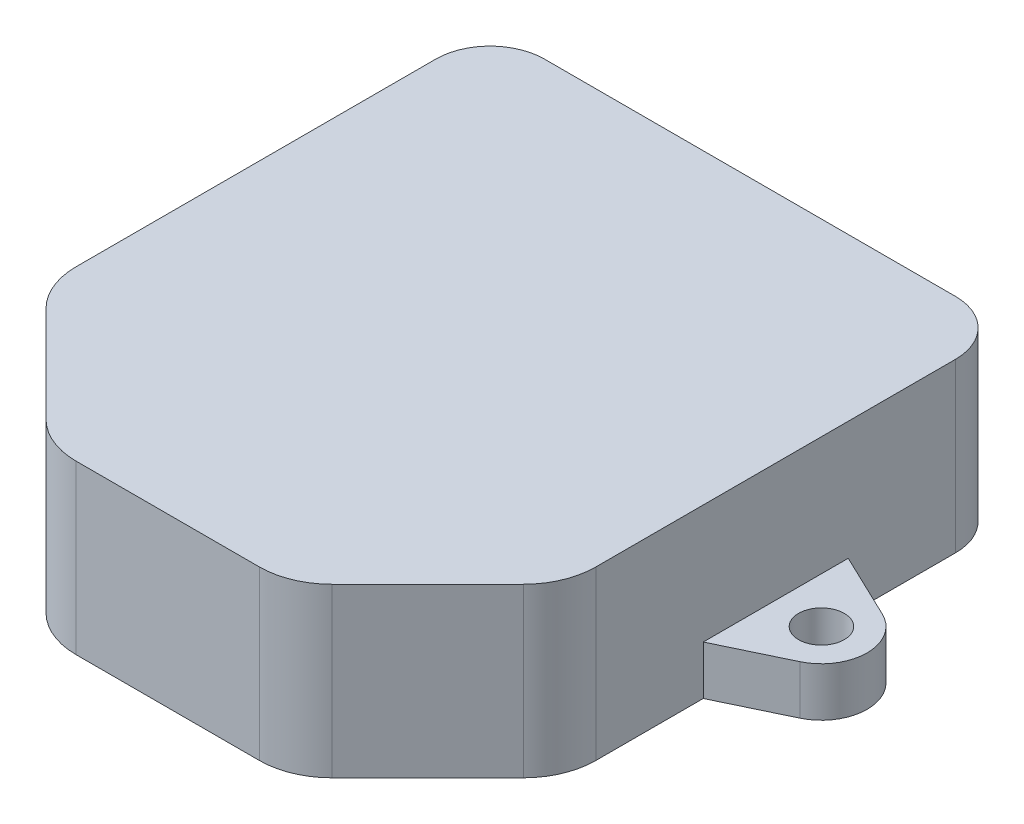
from build123d import *

# Parameters (mm, degrees)
BOSS_EXTRUDE1_DEPTH     = 2.54
BOSS_EXTRUDE2_START     = -23.495
BOSS_EXTRUDE2_DEPTH     = 23.495
CUT_EXTRUDE2_DEPTH      = 20.955
BOSS_EXTRUDE3_DEPTH     = 2.54
SKETCH11_R              = 1.27
BOSS_EXTRUDE4_DEPTH     = 2.54
CUT_EXTRUDE3_DEPTH      = 2.54
CUT_EXTRUDE4_DEPTH      = 2.54
CUT_EXTRUDE4_DEPTH_BACK = 2.54
SKETCH15_W              = 0.800537806
SKETCH15_H              = 10.431424645
SPLIT1_START            = -2.54
SPLIT1_DEPTH            = 11.7475
SKETCH16_R              = 3.2004
SKETCH16_R_2            = 1.6002
SKETCH16_R_3            = 1.27
BOSS_EXTRUDE5_DEPTH     = 3.429
SKETCH21_R              = 1.27
BOSS_EXTRUDE6_DEPTH     = 3.81


# Read off the part's stored shape, not the designer's step: Split1
with BuildPart() as part:
    # Sketch1 → Boss-Extrude1 (new body)
    # profile 1 of 2: a face of its own
    with BuildSketch(Plane(origin=(0, 0, 0), x_dir=(1, 0, 0), z_dir=(0, 1, 0))):
        with BuildLine():
            Line((-1.778, 0), (-1.778, -25.207897552))
            ThreePointArc((-1.778, -25.207897552), (-1.545984815, -26.374316653), (-0.885261469, -27.363159021))
            Line((-0.885261469, -27.363159021), (5.826840979, -34.075261469))
            ThreePointArc((5.826840979, -34.075261469), (6.815683347, -34.735984815), (7.982102448, -34.968))
            Line((7.982102448, -34.968), (20.827897552, -34.968))
            ThreePointArc((20.827897552, -34.968), (21.994316653, -34.735984815), (22.983159021, -34.075261469))
            Line((22.983159021, -34.075261469), (29.695261469, -27.363159021))
            ThreePointArc((29.695261469, -27.363159021), (30.355984815, -26.374316653), (30.588, -25.207897552))
            Line((30.588, -25.207897552), (30.588, 0))
            ThreePointArc((30.588, 0), (30.067235857, 1.257235857), (28.81, 1.778))
            Line((28.81, 1.778), (0, 1.778))
            ThreePointArc((0, 1.778), (-1.257235857, 1.257235857), (-1.778, 0))
        make_face()
        with BuildLine():
            ThreePointArc((0, 1.27), (-0.898025612, 0.898025612), (-1.27, 0))
            Line((-1.27, 0), (-1.27, -25.207897552))
            ThreePointArc((-1.27, -25.207897552), (-1.076654013, -26.17991347), (-0.526051224, -27.003948776))
            Line((-0.526051224, -27.003948776), (6.186051224, -33.716051224))
            ThreePointArc((6.186051224, -33.716051224), (7.01008653, -34.266654013), (7.982102448, -34.46))
            Line((7.982102448, -34.46), (20.827897552, -34.46))
            ThreePointArc((20.827897552, -34.46), (21.79991347, -34.266654013), (22.623948776, -33.716051224))
            Line((22.623948776, -33.716051224), (29.336051224, -27.003948776))
            ThreePointArc((29.336051224, -27.003948776), (29.886654013, -26.17991347), (30.08, -25.207897552))
            Line((30.08, -25.207897552), (30.08, 0))
            ThreePointArc((30.08, 0), (29.708025612, 0.898025612), (28.81, 1.27))
            Line((28.81, 1.27), (0, 1.27))
        make_face(mode=Mode.SUBTRACT)
    # profile 2 of 2: a face of its own
    with BuildSketch(Plane(origin=(0, 0, 0), x_dir=(1, 0, 0), z_dir=(0, 1, 0))):
        with BuildLine():
            Line((28.81, 1.27), (0, 1.27))
            ThreePointArc((0, 1.27), (-0.898025612, 0.898025612), (-1.27, 0))
            Line((-1.27, 0), (-1.27, -25.207897552))
            ThreePointArc((-1.27, -25.207897552), (-1.076654013, -26.17991347), (-0.526051224, -27.003948776))
            Line((-0.526051224, -27.003948776), (6.186051224, -33.716051224))
            ThreePointArc((6.186051224, -33.716051224), (7.01008653, -34.266654013), (7.982102448, -34.46))
            Line((7.982102448, -34.46), (20.827897552, -34.46))
            ThreePointArc((20.827897552, -34.46), (21.79991347, -34.266654013), (22.623948776, -33.716051224))
            Line((22.623948776, -33.716051224), (29.336051224, -27.003948776))
            ThreePointArc((29.336051224, -27.003948776), (29.886654013, -26.17991347), (30.08, -25.207897552))
            Line((30.08, -25.207897552), (30.08, 0))
            ThreePointArc((30.08, 0), (29.708025612, 0.898025612), (28.81, 1.27))
        make_face()
    extrude(amount=-BOSS_EXTRUDE1_DEPTH)

    # Sketch2 → Boss-Extrude2 (add)
    with BuildSketch(Plane.XZ.offset(2.54).offset(BOSS_EXTRUDE2_START)):
        with BuildLine():
            Line((-3.81, 25.207897552), (-3.81, 0))
            ThreePointArc((-3.81, 0), (-2.694076836, -2.694076836), (0, -3.81))
            Line((0, -3.81), (28.81, -3.81))
            ThreePointArc((28.81, -3.81), (31.504076836, -2.694076836), (32.62, 0))
            Line((32.62, 0), (32.62, 25.207897552))
            ThreePointArc((32.62, 25.207897552), (32.233308025, 27.151929388), (31.132102448, 28.8))
            Line((31.132102448, 28.8), (24.42, 35.512102448))
            ThreePointArc((24.42, 35.512102448), (22.771929388, 36.613308025), (20.827897552, 37))
            Line((20.827897552, 37), (7.982102448, 37))
            ThreePointArc((7.982102448, 37), (6.038070612, 36.613308025), (4.39, 35.512102448))
            Line((4.39, 35.512102448), (-2.322102448, 28.8))
            ThreePointArc((-2.322102448, 28.8), (-3.423308025, 27.151929388), (-3.81, 25.207897552))
        make_face()
        with BuildLine():
            ThreePointArc((30.588, 25.207897552), (30.355984815, 26.374316653), (29.695261469, 27.363159021))
            Line((29.695261469, 27.363159021), (22.983159021, 34.075261469))
            ThreePointArc((22.983159021, 34.075261469), (21.994316653, 34.735984815), (20.827897552, 34.968))
            Line((20.827897552, 34.968), (7.982102448, 34.968))
            ThreePointArc((7.982102448, 34.968), (6.815683347, 34.735984815), (5.826840979, 34.075261469))
            Line((5.826840979, 34.075261469), (-0.885261469, 27.363159021))
            ThreePointArc((-0.885261469, 27.363159021), (-1.545984815, 26.374316653), (-1.778, 25.207897552))
            Line((-1.778, 25.207897552), (-1.778, 0))
            ThreePointArc((-1.778, 0), (-1.257235857, -1.257235857), (0, -1.778))
            Line((0, -1.778), (28.81, -1.778))
            ThreePointArc((28.81, -1.778), (30.067235857, -1.257235857), (30.588, 0))
            Line((30.588, 0), (30.588, 25.207897552))
        make_face(mode=Mode.SUBTRACT)
    extrude(amount=BOSS_EXTRUDE2_DEPTH)

    # Sketch9 → Cut-Extrude2 (cut)
    with BuildSketch(Plane(origin=(0, 20.955, 0), x_dir=(1, 0, 0), z_dir=(0, 1, 0))):
        with BuildLine():
            Line((-1.253142306, 1.778), (-1.253142306, 1.261316122))
            ThreePointArc((-1.253142306, 1.261316122), (-1.130998818, 1.371905855), (-0.999142306, 1.470713654))
            Line((-0.999142306, 1.470713654), (-0.999142306, 1.778))
            Line((-0.999142306, 1.778), (-1.253142306, 1.778))
        make_face()
        with BuildLine():
            Line((-0.999142306, 1.778), (-0.999142306, 1.470713654))
            ThreePointArc((-0.999142306, 1.470713654), (-0.522663909, 1.699442979), (0, 1.778))
            Line((0, 1.778), (-0.999142306, 1.778))
        make_face()
        with BuildLine():
            ThreePointArc((28.81, 1.778), (29.333159527, 1.699290472), (29.81, 1.470130606))
            Line((29.81, 1.470130606), (29.81, 1.778))
            Line((29.81, 1.778), (28.81, 1.778))
        make_face()
        with BuildLine():
            ThreePointArc((29.81, 1.470130606), (29.941398884, 1.371575942), (30.063142306, 1.261316122))
            Line((30.063142306, 1.261316122), (30.063142306, 1.778))
            Line((30.063142306, 1.778), (29.81, 1.778))
            Line((29.81, 1.778), (29.81, 1.470130606))
        make_face()
    extrude(amount=-CUT_EXTRUDE2_DEPTH, mode=Mode.SUBTRACT)

    # Sketch10 → Boss-Extrude3 (add)
    with BuildSketch(Plane(origin=(0, 20.955, 0), x_dir=(1, 0, 0), z_dir=(0, 1, 0))):
        with BuildLine():
            Line((-3.81, 0), (-3.81, -25.207897552))
            ThreePointArc((-3.81, -25.207897552), (-3.423308025, -27.151929388), (-2.322102448, -28.8))
            Line((-2.322102448, -28.8), (4.39, -35.512102448))
            ThreePointArc((4.39, -35.512102448), (6.038070612, -36.613308025), (7.982102448, -37))
            Line((7.982102448, -37), (20.827897552, -37))
            ThreePointArc((20.827897552, -37), (22.771929388, -36.613308025), (24.42, -35.512102448))
            Line((24.42, -35.512102448), (31.132102448, -28.8))
            ThreePointArc((31.132102448, -28.8), (32.233308025, -27.151929388), (32.62, -25.207897552))
            Line((32.62, -25.207897552), (32.62, 0))
            ThreePointArc((32.62, 0), (31.504076836, 2.694076836), (28.81, 3.81))
            Line((28.81, 3.81), (0, 3.81))
            ThreePointArc((0, 3.81), (-2.694076836, 2.694076836), (-3.81, 0))
        make_face()
    extrude(amount=-BOSS_EXTRUDE3_DEPTH)

    # Sketch11 → Boss-Extrude4 (add)
    with BuildSketch(Plane(origin=(0, 0, 0), x_dir=(1, 0, 0), z_dir=(0, 1, 0))):
        with Locations(Location((2.371622665, -3.626580703, 0), (0, 0, 270))):
            Circle(SKETCH11_R)
        with Locations(Location((26.438377335, -3.626580703, 0), (0, 0, 270))):
            Circle(SKETCH11_R)
        with Locations(Location((2.371622665, -26.04201004, 0), (0, 0, 270))):
            Circle(SKETCH11_R)
        with Locations(Location((26.438377335, -26.04201004, 0), (0, 0, 270))):
            Circle(SKETCH11_R)
    extrude(amount=BOSS_EXTRUDE4_DEPTH)

    # Sketch8 → Cut-Extrude3 (cut)
    with BuildSketch(Plane(origin=(0, 0, -3.81), x_dir=(-1, 0, 0), z_dir=(0, 0, -1))):
        with BuildLine():
            ThreePointArc((-29.81, 5.625), (-29.804353285, 5.503964576), (-29.787462194, 5.383980617))
            Line((-29.787462194, 5.383980617), (0.977462194, 5.383980617))
            ThreePointArc((0.977462194, 5.383980617), (0.994353285, 5.503964576), (1, 5.625))
            Line((1, 5.625), (1, 15.575))
            ThreePointArc((1, 15.575), (0.994382339, 15.695724314), (0.977577908, 15.815405262))
            Line((0.977577908, 15.815405262), (-29.787577908, 15.815405262))
            ThreePointArc((-29.787577908, 15.815405262), (-29.804382339, 15.695724314), (-29.81, 15.575))
            Line((-29.81, 15.575), (-29.81, 5.625))
        make_face()
    extrude(amount=-CUT_EXTRUDE3_DEPTH, mode=Mode.SUBTRACT)

    # Sketch15 → Cut-Extrude4 (cut, two sides: drawn at the far end of the back side and taken through both)
    with BuildSketch(Plane.XY.offset(-1.778).offset(-CUT_EXTRUDE4_DEPTH_BACK)):
        with Locations((-1.377731097, 10.59969294)):
            Rectangle(SKETCH15_W, SKETCH15_H)
        with Locations((30.187731097, 10.59969294)):
            Rectangle(SKETCH15_W, SKETCH15_H)
    extrude(amount=CUT_EXTRUDE4_DEPTH + CUT_EXTRUDE4_DEPTH_BACK, mode=Mode.SUBTRACT)

    # Split1 outline → Split1 (cut)
    with BuildSketch(Plane(origin=(0, 0, 0), x_dir=(1, 0, 0), z_dir=(0, 1, 0)).offset(SPLIT1_START)):
        with BuildLine():
            Line((28.81, 3.81), (0, 3.81))
            ThreePointArc((0, 3.81), (-2.694076836, 2.694076836), (-3.81, 0))
            Line((-3.81, 0), (-3.81, -25.207897552))
            ThreePointArc((-3.81, -25.207897552), (-3.423308025, -27.151929388), (-2.322102448, -28.8))
            Line((-2.322102448, -28.8), (4.39, -35.512102448))
            ThreePointArc((4.39, -35.512102448), (6.038070612, -36.613308025), (7.982102448, -37))
            Line((7.982102448, -37), (20.827897552, -37))
            ThreePointArc((20.827897552, -37), (22.771929388, -36.613308025), (24.42, -35.512102448))
            Line((24.42, -35.512102448), (31.132102448, -28.8))
            ThreePointArc((31.132102448, -28.8), (32.233308025, -27.151929388), (32.62, -25.207897552))
            Line((32.62, -25.207897552), (32.62, 0))
            ThreePointArc((32.62, 0), (31.504076836, 2.694076836), (28.81, 3.81))
        make_face()
    extrude(amount=SPLIT1_DEPTH, mode=Mode.SUBTRACT)

    # Sketch16 → Boss-Extrude5 (add)
    # profile 1 of 7: a face of its own
    with BuildSketch(Plane.XZ.offset(-9.2075)):
        with BuildLine():
            Line((-3.81, 12.603948776), (-3.81, 17.683948776))
            Line((-3.81, 17.683948776), (-8.392146181, 15.49070087))
            ThreePointArc((-8.392146181, 15.49070087), (-5.304466285, 15.31178007), (-3.81, 12.603948776))
        make_face()
    # profile 2 of 7: a face of its own
    with BuildSketch(Plane.XZ.offset(-9.2075)):
        with Locations((-7.0104, 12.603948776)):
            Circle(SKETCH16_R)
        with Locations(Location((-7.0104, 12.603948776, 0), (0, 0, 270))):
            Circle(SKETCH16_R_2, mode=Mode.SUBTRACT)
    # profile 3 of 7: a face of its own
    with BuildSketch(Plane.XZ.offset(-9.2075)):
        with BuildLine():
            Line((-3.81, 7.523948776), (-3.81, 12.603948776))
            ThreePointArc((-3.81, 12.603948776), (-5.304466285, 9.896117481), (-8.392146181, 9.717196682))
            Line((-8.392146181, 9.717196682), (-3.81, 7.523948776))
        make_face()
    # profile 4 of 7: a face of its own
    with BuildSketch(Plane.XZ.offset(-9.2075)):
        with BuildLine():
            Line((32.62, 12.603948776), (32.62, 7.523948776))
            Line((32.62, 7.523948776), (37.202146181, 9.717196682))
            ThreePointArc((37.202146181, 9.717196682), (34.114466285, 9.896117481), (32.62, 12.603948776))
        make_face()
    # profile 5 of 7: a face of its own
    with BuildSketch(Plane.XZ.offset(-9.2075)):
        with Locations((35.8204, 12.603948776)):
            Circle(SKETCH16_R)
        with Locations(Location((35.8204, 12.603948776, 0), (0, 0, 270))):
            Circle(SKETCH16_R_2, mode=Mode.SUBTRACT)
    # profile 6 of 7: a face of its own
    with BuildSketch(Plane.XZ.offset(-9.2075)):
        with BuildLine():
            Line((32.62, 17.683948776), (32.62, 12.603948776))
            ThreePointArc((32.62, 12.603948776), (34.114466285, 15.31178007), (37.202146181, 15.49070087))
            Line((37.202146181, 15.49070087), (32.62, 17.683948776))
        make_face()
    # profile 7 of 7: a face of its own
    with BuildSketch(Plane.XZ.offset(-9.2075)):
        with Locations((35.8204, 12.603948776)):
            Circle(SKETCH16_R_3)
    extrude(amount=-BOSS_EXTRUDE5_DEPTH)


with BuildPart() as boss_extrude5_kept_piece:
    # of the separate pieces the step leaves, the one the design keeps (boss_extrude5_pieces_kept)
    add(part.part.solids().sort_by_distance((-3.81, 20.955, 0))[0])

    # Sketch21 → Boss-Extrude6 (add)
    with BuildSketch(Plane.XZ.offset(-18.415)):
        with Locations(Location((14.405, 6.35, 0), (0, 0, 90))):
            Circle(SKETCH21_R)
    extrude(amount=BOSS_EXTRUDE6_DEPTH)


solid = boss_extrude5_kept_piece.part
